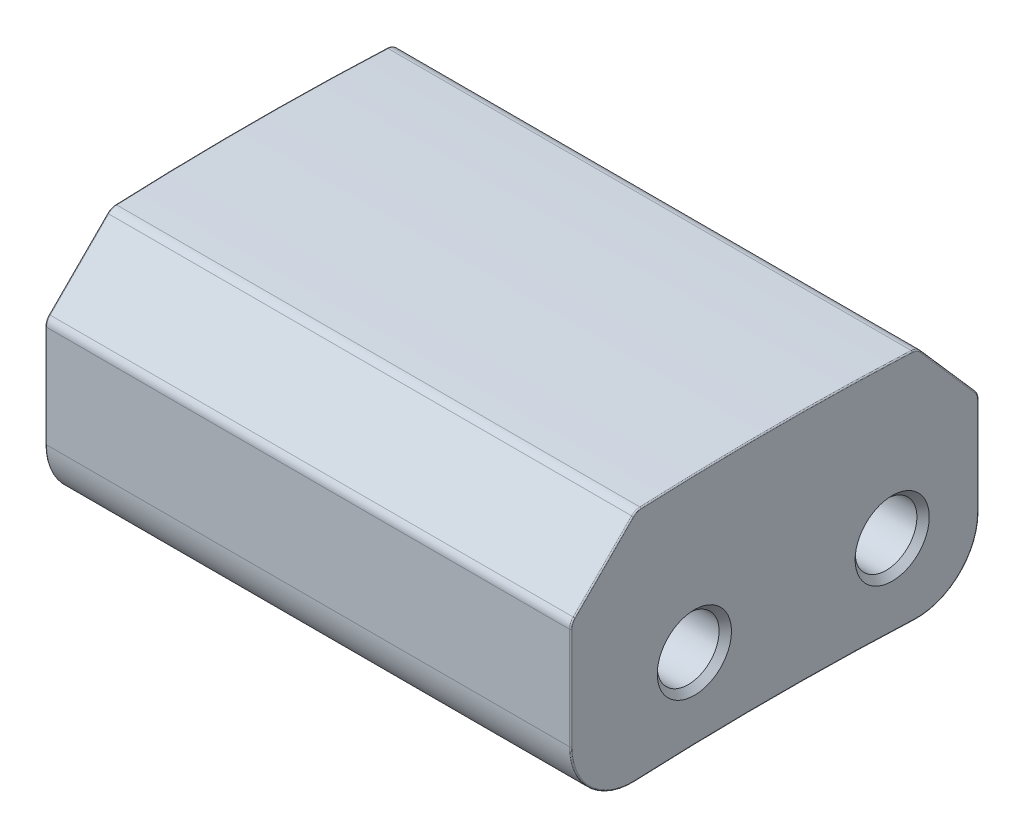
from build123d import *

# Parameters (mm, degrees)
SKETCH1_W           = 8.5
SKETCH1_H           = 6.6
BOSS_EXTRUDE1_DEPTH = 4.2
CUT_EXTRUDE1_DEPTH  = 14.2
CHAMFER1_SIZE       = 1.073169072
CHAMFER1_SIZE_2     = 1
FILLET1_R           = 1
FILLET2_R           = 0.2
FILLET3_R           = 0.02
SKETCH3_R           = 0.5
CUT_EXTRUDE2_DEPTH  = 14.2
CHAMFER2_SIZE       = 0.1


with BuildPart() as part:
    # Sketch1 → Boss-Extrude1 (new body)
    with BuildSketch(Plane(origin=(0, 0, 0), x_dir=(1, 0, 0), z_dir=(0, 1, 0))):
        Rectangle(SKETCH1_W, SKETCH1_H)
    extrude(amount=BOSS_EXTRUDE1_DEPTH)

    # Sketch2 → Cut-Extrude1 (cut)
    with BuildSketch(Plane(origin=(4.25, 0, 0), x_dir=(0, 0, -1), z_dir=(1, 0, 0))):
        with BuildLine():
            Line((-3.3, 3.9), (-5.253535024, 5.241651662))
            Line((-5.253535024, 5.241651662), (3.889156526, 7.141243929))
            Line((3.889156526, 7.141243929), (5.679183493, 5.077233243))
            Line((5.679183493, 5.077233243), (3.3, 3.9))
            ThreePointArc((3.3, 3.9), (0, 4.009018851), (-3.3, 3.9))
        make_face()
        with BuildLine():
            Line((4.717394395, 0), (0, -2.904825783))
            Line((0, -2.904825783), (-4.70037365, 0))
            ThreePointArc((-4.70037365, 0), (0.008510373, 0.222229748), (4.717394395, 0))
        make_face()
    extrude(amount=-CUT_EXTRUDE1_DEPTH, mode=Mode.SUBTRACT)

    # Chamfer1
    # the kernel refuses this chamfer: 1.073169072, 1 mm, written as the material it takes off along each edge
    with BuildSketch(Plane(origin=(7.014554566, 3.9, -3.3), x_dir=(0, -1, 0), z_dir=(-1, 0, 0))) as chamfer1_piece_1:
        with BuildLine():
            Line((CHAMFER1_SIZE, 0), (-0.05556839, 0.98868238))
            ThreePointArc((-0.05556839, 0.98868238), (-0.031072564, 0.509202078), (0, 0))
            Line((0, 0), (CHAMFER1_SIZE, 0))
        make_face()
    extrude(amount=14.029109133, mode=Mode.SUBTRACT)
    with BuildSketch(Plane(origin=(6.981889399, 3.9, 3.3), x_dir=(0, 0.05541549441613883, -0.9984633808901632), z_dir=(-1, 0, 0))) as chamfer1_piece_2:
        with BuildLine():
            Line((1.060391539, 0), (-CHAMFER1_SIZE_2 * 0.0554154944161, CHAMFER1_SIZE_2 * 0.99846338089))
            Line((-CHAMFER1_SIZE_2 * 0.0554154944161, CHAMFER1_SIZE_2 * 0.99846338089), (0, 0))
            ThreePointArc((0, 0), (0.546186707, -0.002808597), (1.060391539, 0))
        make_face()
    extrude(amount=13.963778797, mode=Mode.SUBTRACT)

    # Fillet1
    fillet1_edges = [part.edges().sort_by_distance(p)[0] for p in [
        (0, 0.11377308, -3.3),
        (0, 0.112647256, 3.3),
    ]]
    fillet(fillet1_edges, radius=FILLET1_R)

    # Fillet2
    fillet2_edges = [part.edges().sort_by_distance(p)[0] for p in [
        (0, 2.826830928, -3.3),
        (0, 3.958762121, 2.241237879),
        (0, 3.95556839, -2.31131762),
        (0, 2.9, 3.3),
    ]]
    fillet(fillet2_edges, radius=FILLET2_R)

    # Fillet3
    fillet3_edges = [part.edges().sort_by_distance(p)[0] for p in [
        (4.25, 0.22222905, -0.000158372),
        (4.25, 0.447906277, -2.99103865),
        (4.25, 0.447022472, 2.990917901),
        (-4.25, 0.22222905, -0.000158372),
        (-4.25, 0.447906277, -2.99103865),
        (-4.25, 0.447022472, 2.990917901),
        (4.25, 1.961174313, -3.3),
        (-4.25, 1.961174313, -3.3),
        (4.25, 1.993556495, 3.3),
        (4.25, 3.387413237, -2.808975408),
        (4.25, 4.009009057, -0.031295116),
        (4.25, 3.431189943, 2.768810057),
        (4.25, 2.893693974, 3.284775907),
        (4.25, 3.94545632, 2.235294601),
        (4.25, 3.939907453, -2.30368815),
        (4.25, 2.822018564, -3.287202247),
        (-4.25, 3.387413237, -2.808975408),
        (-4.25, 1.993556495, 3.3),
        (-4.25, 3.431189943, 2.768810057),
        (-4.25, 4.009009057, -0.031295116),
        (-4.25, 2.893693974, 3.284775907),
        (-4.25, 3.94545632, 2.235294601),
        (-4.25, 3.939907453, -2.30368815),
        (-4.25, 2.822018564, -3.287202247),
    ]]
    fillet(fillet3_edges, radius=FILLET3_R)

    # Sketch3 → Cut-Extrude2 (cut)
    with BuildSketch(Plane.ZY.offset(4.25)):
        with Locations((-1.9, 1.5)):
            Circle(SKETCH3_R)
        with Locations((1.3, 1.5)):
            Circle(SKETCH3_R)
    extrude(amount=-CUT_EXTRUDE2_DEPTH, mode=Mode.SUBTRACT)

    # Chamfer2
    chamfer2_edges = [part.edges().sort_by_distance(p)[0] for p in [
        (4.25, 1.5, -2.4),
        (-4.25, 1.5, -2.4),
        (4.25, 1.5, 0.8),
        (-4.25, 1.5, 0.8),
    ]]
    chamfer(chamfer2_edges, length=CHAMFER2_SIZE)


solid = part.part
